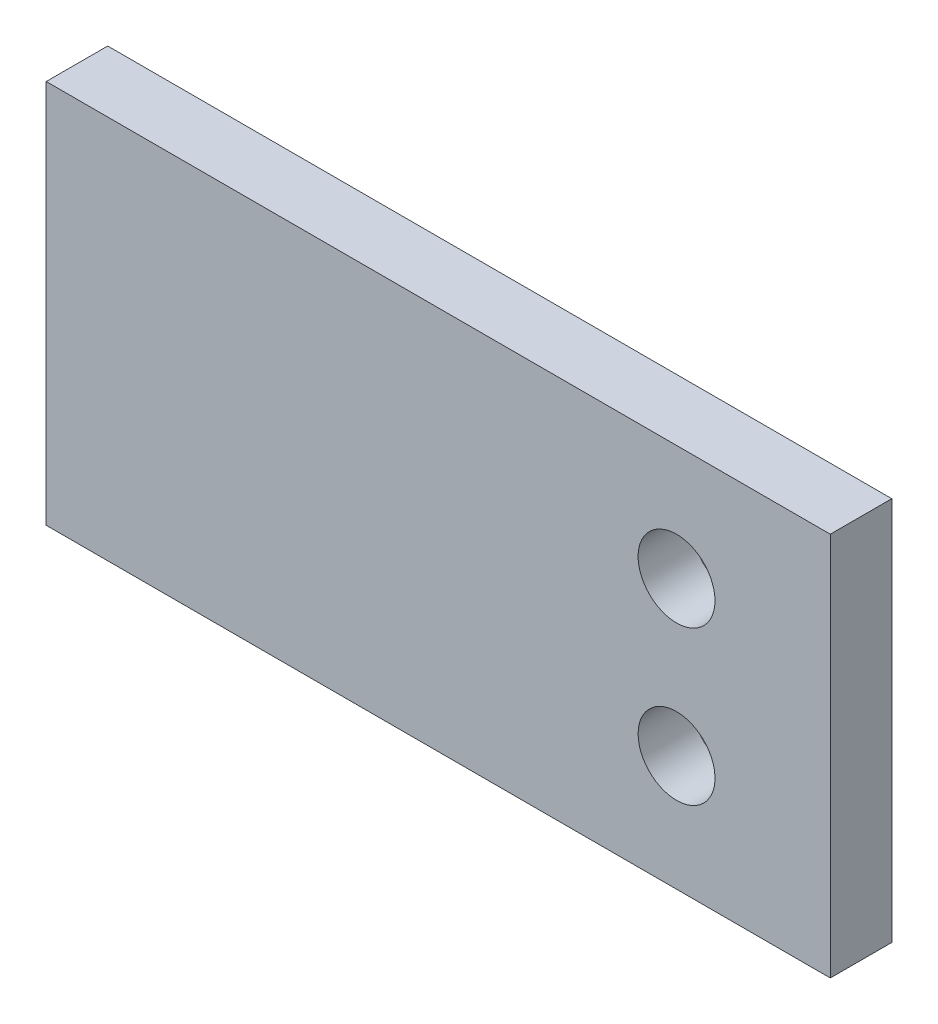
from build123d import *

# Parameters (mm, degrees)
SKETCH1_W               = 40
SKETCH1_H               = 25
BOSS_EXTRUDE1_DEPTH     = 4
SKETCH7_W               = 9
SKETCH7_H               = 25
CUT_EXTRUDE5_DEPTH      = 21
SKETCH8_W               = 20
SKETCH8_H               = 25
BOSS_EXTRUDE2_DEPTH     = 4
CUT_EXTRUDE6_DEPTH      = 43.09809972
CUT_EXTRUDE6_DEPTH_BACK = 43.09809972
SKETCH9_R               = 2.5
CUT_EXTRUDE7_DEPTH      = 0.5
FILLET1_R               = 1


with BuildPart() as part:
    # Sketch1 → Boss-Extrude1 (new body)
    with BuildSketch(Plane.XY):
        Rectangle(SKETCH1_W, SKETCH1_H)
    extrude(amount=BOSS_EXTRUDE1_DEPTH)

    # Sketch7 → Cut-Extrude5 (cut)
    with BuildSketch(Plane.XY):
        with Locations((-15.5, 0)):
            Rectangle(SKETCH7_W, SKETCH7_H)
    extrude(amount=CUT_EXTRUDE5_DEPTH, mode=Mode.SUBTRACT)

    # Sketch8 → Boss-Extrude2 (add)
    with BuildSketch(Plane.XY):
        with Locations((30, 0)):
            Rectangle(SKETCH8_W, SKETCH8_H)
    extrude(amount=BOSS_EXTRUDE2_DEPTH)

    # Sketch9 → Cut-Extrude6 (cut, two sides: drawn at the far end of the back side and taken through both)
    with BuildSketch(Plane.XY.offset(-CUT_EXTRUDE6_DEPTH_BACK)):
        with Locations((30, 5)):
            Circle(SKETCH9_R)
        with Locations((30, -4.993535343)):
            Circle(SKETCH9_R)
    extrude(amount=CUT_EXTRUDE6_DEPTH + CUT_EXTRUDE6_DEPTH_BACK, mode=Mode.SUBTRACT)

    # Sketch10 → Cut-Extrude7 (cut)
    with BuildSketch(Plane.XY):
        with BuildLine():
            Line((32.5, 0.669872981), (32.5, -0.663408324))
            ThreePointArc((32.5, -0.663408324), (30, -9.993535343), (27.5, -0.663408324))
            Line((27.5, -0.663408324), (27.5, 0.669872981))
            ThreePointArc((27.5, 0.669872981), (30, 10), (32.5, 0.669872981))
        make_face()
    extrude(amount=CUT_EXTRUDE7_DEPTH, mode=Mode.SUBTRACT)

    # Fillet1
    fillet1_edges = [part.edges().sort_by_distance(p)[0] for p in [
        (27.5, -0.663408324, 0.25),
        (27.5, 0.669872981, 0.25),
        (32.5, -0.663408324, 0.25),
        (32.5, 0.669872981, 0.25),
    ]]
    fillet(fillet1_edges, radius=FILLET1_R)


solid = part.part
